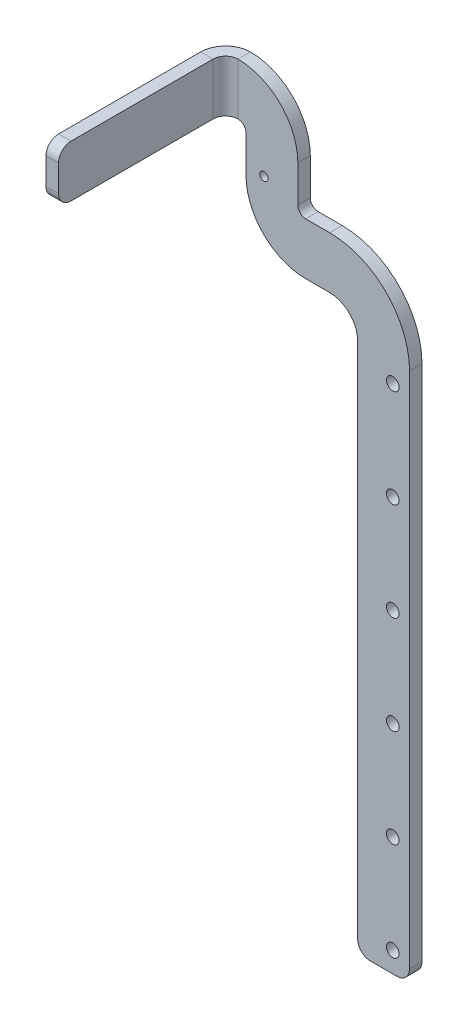
from build123d import *

# Parameters (mm, degrees)
BOSS_EXTRUDE1_DEPTH = 3.125
EDGE_FLANGE1_DEPTH  = 13
FILLET1_R           = 3.175
SKETCH10_R          = 1.5875
CUT_EXTRUDE1_DEPTH  = 10
LPATTERN1_COUNT     = 6
LPATTERN1_PITCH     = 24.6
SKETCH13_R          = 1.05
CUT_EXTRUDE2_DEPTH  = 10


# Sheet-metal steps are written as plain solids
with BuildPart() as part:
    # Sketch1 → Boss-Extrude1 (new body)
    with BuildSketch(Plane.XY):
        with BuildLine():
            Line((123482.998157255, 24999.885796135), (123482.998157255, 25132.885796135))
            ThreePointArc((123482.998157255, 25132.885796135), (123482.99666513, 25133.030321276), (123482.992189393, 25133.174784804))
            ThreePointArc((123482.992189393, 25133.174784804), (123480.844655225, 25137.936682931), (123475.998158089, 25139.885796135))
            Line((123475.998158089, 25139.885796135), (123469.998184079, 25139.88579685))
            ThreePointArc((123469.998184079, 25139.88579685), (123459.391582886, 25144.279196396), (123454.998185868, 25154.885798636))
            Line((123454.998185868, 25154.885798636), (123454.998186963, 25164.077536847))
            ThreePointArc((123454.998186963, 25164.077536847), (123454.412390106, 25165.491761067), (123452.998157255, 25166.077537085))
            Line((123452.998157255, 25166.077537085), (123452.998157255, 25179.077537085))
            ThreePointArc((123452.998157255, 25179.077537085), (123463.604778809, 25174.684148675), (123467.998186963, 25164.077535299))
            Line((123467.998186963, 25164.077535299), (123467.998185868, 25154.885797087))
            ThreePointArc((123467.998185868, 25154.885797087), (123468.583972137, 25153.471583456), (123469.998185629, 25152.88579685))
            Line((123469.998185629, 25152.88579685), (123475.998159637, 25152.885796136))
            ThreePointArc((123475.998159637, 25152.885796136), (123490.140293721, 25147.027930917), (123495.998157255, 25132.885796135))
            Line((123495.998157255, 25132.885796135), (123495.998157255, 25003.060796135))
            ThreePointArc((123495.998157255, 25003.060796135), (123495.068221285, 25000.815732105), (123492.823157255, 24999.885796135))
            Line((123492.823157255, 24999.885796135), (123482.998157255, 24999.885796135))
        make_face()
    extrude(amount=BOSS_EXTRUDE1_DEPTH)

    # Edge-Flange1 section (across the edge) → Edge-Flange1 (add)
    with BuildSketch(Plane(origin=(123449.873157255, 25179.077537085, 3.125), x_dir=(1, 0, 0), z_dir=(0, -1, 0))):
        with BuildLine():
            Line((-3.125, 3.125), (-3.125, 41.875))
            Line((-3.125, 41.875), (0, 41.875))
            Line((0, 41.875), (0, 3.125))
            ThreePointArc((0, 3.125), (0.915291309, 0.915291309), (3.125, 0))
            Line((3.125, 0), (3.125, -3.125))
            ThreePointArc((3.125, -3.125), (-1.294417382, -1.294417382), (-3.125, 3.125))
        make_face()
    extrude(amount=EDGE_FLANGE1_DEPTH)

    # Fillet1
    fillet1_edges = [part.edges().sort_by_distance(p)[0] for p in [
        (123482.998157255, 24999.885796135, 1.5625),
        (123448.310657255, 25179.077537085, 45),
        (123448.310657255, 25166.077537085, 45),
    ]]
    fillet(fillet1_edges, radius=FILLET1_R)

    # Sketch10 → Cut-Extrude1 (cut)
    with BuildSketch(Plane.XY.offset(3.125)):
        with Locations((123491.798157255, 25005.027537086)):
            Circle(SKETCH10_R)
    cut_extrude1 = extrude(amount=-CUT_EXTRUDE1_DEPTH, mode=Mode.SUBTRACT)

    # LPattern1: Cut-Extrude1 ×6
    with Locations(*[(0, i * LPATTERN1_PITCH, 0) for i in range(1, LPATTERN1_COUNT)]):
        add(cut_extrude1, mode=Mode.SUBTRACT)

    # Sketch13 → Cut-Extrude2 (cut)
    with BuildSketch(Plane(origin=(0, 0, 0), x_dir=(-1, 0, 0), z_dir=(0, 0, -1))):
        with Locations((-123459.498186107, 25156.8857981)):
            Circle(SKETCH13_R)
    extrude(amount=-CUT_EXTRUDE2_DEPTH, mode=Mode.SUBTRACT)


solid = part.part
